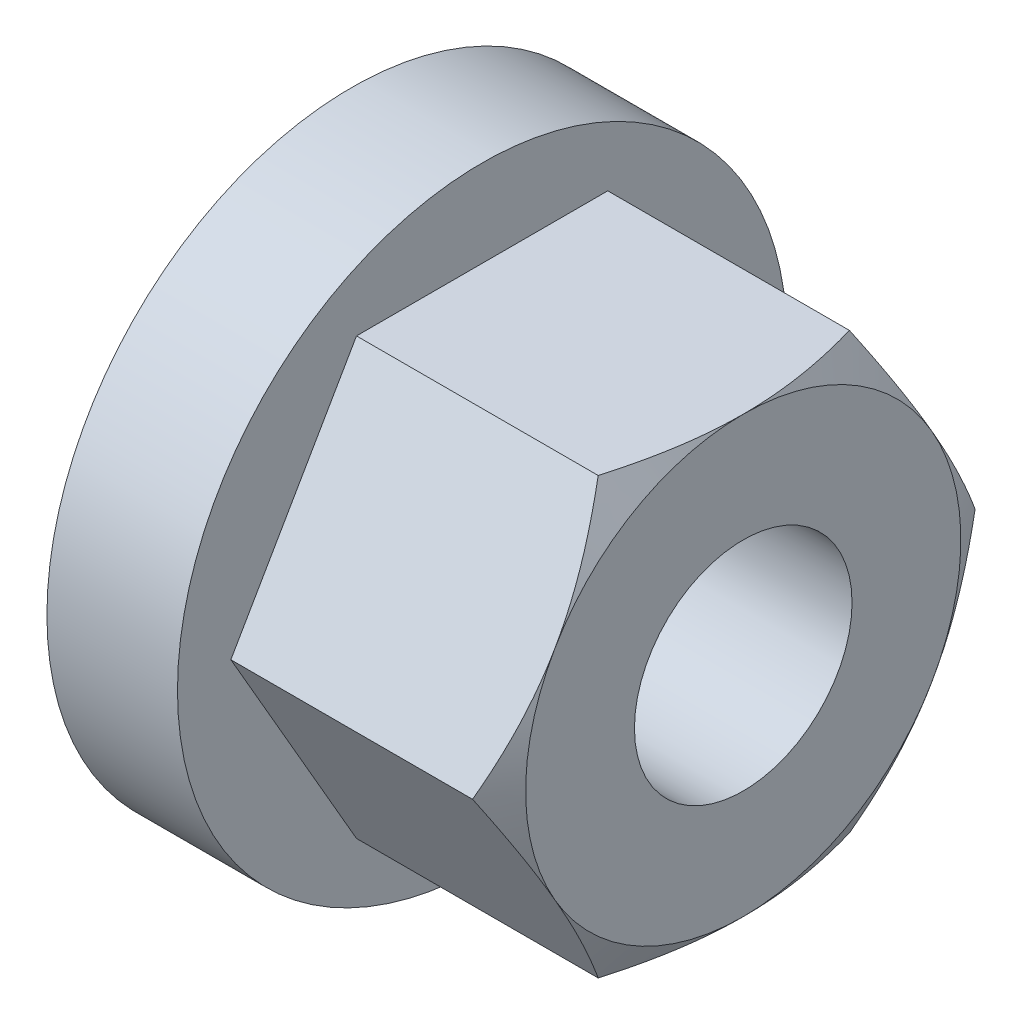
from build123d import *

# Parameters (mm, degrees)
SKETCH1_R      = 2.5
EXTRUDE1_DEPTH = 9
SKETCH3_W      = 3
SKETCH3_H      = 4.5


# Read off the part's stored shape, not the designer's step: Cut-Extrude1
with BuildPart() as part:
    # Sketch1 → Extrude1 (new body)
    with BuildSketch(Plane(origin=(0, 0, 0), x_dir=(0, 0, -1), z_dir=(1, 0, 0))):
        Polygon((5.773502692, 0), (2.886751346, 5), (-2.886751346, 5), (-5.773502692, 0), (-2.886751346, -5), (2.886751346, -5), align=None)
        Circle(SKETCH1_R, mode=Mode.SUBTRACT)
    extrude(amount=EXTRUDE1_DEPTH)

    # Cut-Extrude1 outline → Cut-Extrude1 (revolve, cut)
    with BuildSketch(Plane.YX):
        Polygon((5.773502692, 9.000000845), (4.99999886, 9.000000845), (5.773502688, 8.553418015), align=None)
    revolve(axis=Axis((0, 0, 0), (1, 0, 0)), mode=Mode.SUBTRACT)

    # Sketch3 → Revolve1 (revolve)
    with BuildSketch(Plane.XY, mode=Mode.PRIVATE) as revolve1_sk:
        with Locations((1.5, 4.75)):
            Rectangle(SKETCH3_W, SKETCH3_H)
    revolve(revolve1_sk.sketch.rotate(Axis((0, 0, 0), (-1, 0, 0)), 90), axis=Axis((0, 0, 0), (-1, 0, 0)))


solid = part.part
